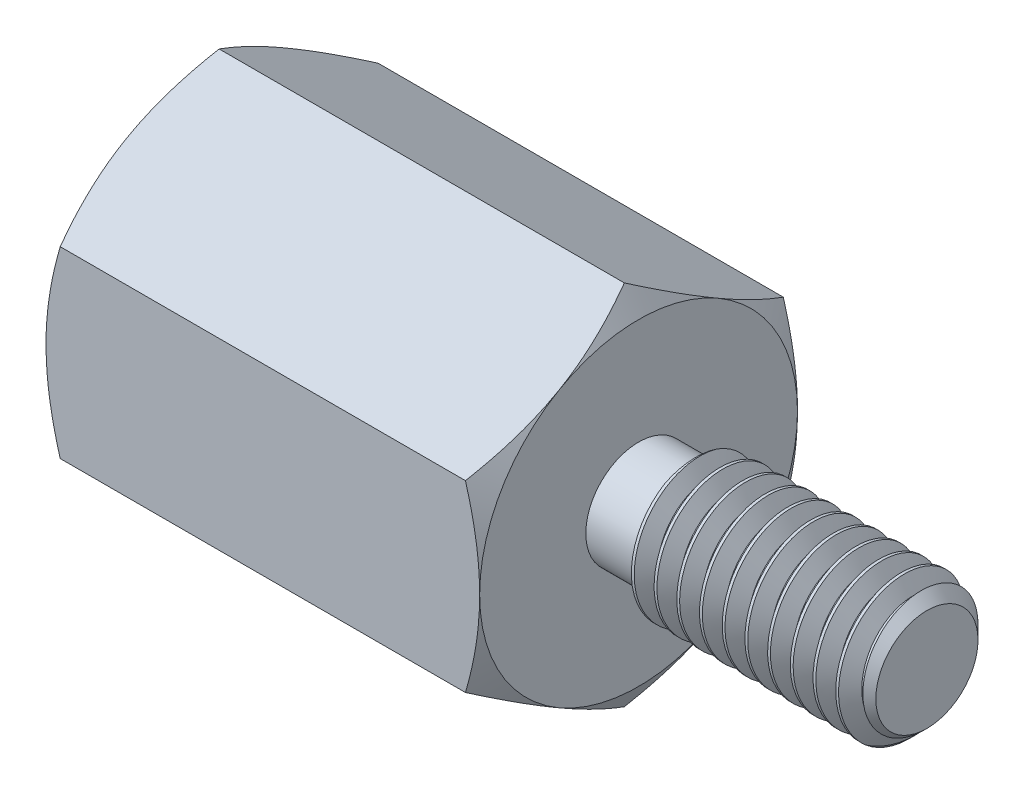
from build123d import *

# Parameters (mm, degrees)
EXTRUDE1_DEPTH    = 19.1
SKETCH3_R         = 4
EXTRUDE3_DEPTH    = 9.5
SWEEP1_PITCH      = 1.25
EXTRUDE7_DEPTH    = 22.889342986
SKETCH6_OUTSIDE_W = 101.026
SKETCH6_OUTSIDE_H = 103.192
SKETCH6_OUTSIDE_R = 7
EXTRUDE5_DEPTH    = 22.889343004
EXTRUDE5_DRAFT    = -60
SKETCH7_OUTSIDE_W = 101.026
SKETCH7_OUTSIDE_H = 103.192
SKETCH7_OUTSIDE_R = 7
EXTRUDE6_DEPTH    = 22.889342917
EXTRUDE6_DRAFT    = -60
SKETCH4_R         = 3
EXTRUDE4_DEPTH    = 12.7
CHAMFER1_SIZE     = 0.75
CUT_SWEEP1_PITCH  = 1
CUT_SWEEP1_FROM   = 0


with BuildPart() as part:
    # Sketch2 → Extrude1 (new body)
    with BuildSketch(Plane(origin=(19.1, 0, 0), x_dir=(0, 0, -1), z_dir=(1, 0, 0))):
        Polygon((0, 8.082903769), (-7, 4.041451884), (-7, -4.041451884), (0, -8.082903769), (7, -4.041451884), (7, 4.041451884), align=None)
    extrude(amount=-EXTRUDE1_DEPTH)

    # Sketch3 → Extrude3 (cut)
    with BuildSketch(Plane.ZY):
        Circle(SKETCH3_R)
    extrude(amount=-EXTRUDE3_DEPTH, mode=Mode.SUBTRACT)

    # Sweep1: arcs per turn and ends read off the stored shape
    # Sweep1: the profile of Sketch9 profile screwed along a right-hand helix through 9.6 turns, 8 arcs to a turn; built about Z, then put on its axis
    sweep1_z = Axis((0, 0, 0), (0, 0, 1))
    sweep1_corners = [(4.0003, 0, -0.547048205), (4.0003, 0, 0.547048205), (3.188101184, 0, 0.078125), (3.188101184, 0, -0.078125)]
    with BuildLine(mode=Mode.PRIVATE) as sweep1_profile:
        Line(sweep1_corners[0], sweep1_corners[1])
        Line(sweep1_corners[1], sweep1_corners[2])
        Line(sweep1_corners[2], sweep1_corners[3])
        Line(sweep1_corners[3], sweep1_corners[0])
    sweep1_cap = Face(sweep1_profile.wire())
    sweep1_turn_angles = [0, 22.5, 45, 67.5, 90, 112.5, 135, 157.5, 180, 202.5, 225, 247.5, 270, 292.5, 315, 337.5, 360]
    sweep1_turn_weights = [1, 0.9238795325112867, 1, 0.9238795325112867, 1, 0.9238795325112867, 1, 0.9238795325112867, 1, 0.9238795325112867, 1, 0.9238795325112867, 1, 0.9238795325112867, 1, 0.9238795325112867, 1]
    sweep1_turn_rails = [Edge.make_bspline([Vector(p[0], p[1], 0).rotate(sweep1_z, sweep1_turn_angles[k]) / sweep1_turn_weights[k] + Vector(0, 0, p[2] + SWEEP1_PITCH * sweep1_turn_angles[k] / 360) for k in range(17)], [0, 0, 0, 1, 1, 2, 2, 3, 3, 4, 4, 5, 5, 6, 6, 7, 7, 8, 8, 8], 2, sweep1_turn_weights) for p in sweep1_corners]
    sweep1_turn_sides = [Face.make_surface_from_curves(sweep1_turn_rails[p[0]], sweep1_turn_rails[p[1]]) for p in [(0, 1), (1, 2), (2, 3), (3, 0)]]
    sweep1_last_angles = [3240, 3262.5, 3285, 3307.5, 3330, 3352.5, 3375, 3397.5, 3420, 3438, 3456]
    sweep1_last_weights = [1, 0.9238795325112867, 1, 0.9238795325112867, 1, 0.9238795325112867, 1, 0.9238795325112867, 1, 0.9510565162951364, 1]
    sweep1_last_rails = [Edge.make_bspline([Vector(p[0], p[1], 0).rotate(sweep1_z, sweep1_last_angles[k]) / sweep1_last_weights[k] + Vector(0, 0, p[2] + SWEEP1_PITCH * sweep1_last_angles[k] / 360) for k in range(11)], [0, 0, 0, 1, 1, 2, 2, 3, 3, 4, 4, 5, 5, 5], 2, sweep1_last_weights) for p in sweep1_corners]
    sweep1_last_sides = [Face.make_surface_from_curves(sweep1_last_rails[p[0]], sweep1_last_rails[p[1]]) for p in [(0, 1), (1, 2), (2, 3), (3, 0)]]
    sweep1 = Plane(origin=(9.5, 0, 0), x_dir=(0, 1, 0), z_dir=(-1, 0, 0)) * Solid(Shell([*[p.moved(Location((0, 0, SWEEP1_PITCH * i))) for i in range(9) for p in sweep1_turn_sides], *sweep1_last_sides, sweep1_cap, sweep1_cap.rotate(sweep1_z, 3456).moved(Location((0, 0, SWEEP1_PITCH * 3456 / 360)))]))
    add(sweep1)

    # Sketch10 → Extrude7 (cut, through all)
    with BuildSketch(Plane.ZY):
        Polygon((0, 8.082903769), (-7, 4.041451884), (-7, -4.041451884), (0, -8.082903769), (7, -4.041451884), (7, 4.041451884), align=None)
    extrude(amount=EXTRUDE7_DEPTH, mode=Mode.SUBTRACT)

    # Extrude8 cone 1 section (through the dimple's axis) → Extrude8 (revolve, cut)
    with BuildSketch(Plane.ZX):
        Polygon((0, 0), (4.0762, 0), (0, 4.0762), align=None)
    revolve(axis=Axis((0, 0, 0), (1, 0, 0)), mode=Mode.SUBTRACT)


with BuildPart() as extrude5_tool:
    # Sketch6 outside → Extrude5 (with draft: the straight prism first)
    with BuildSketch(Plane(origin=(19.1, 0, 0), x_dir=(0, 0, -1), z_dir=(1, 0, 0))):
        Rectangle(SKETCH6_OUTSIDE_W, SKETCH6_OUTSIDE_H)
        Circle(SKETCH6_OUTSIDE_R, mode=Mode.SUBTRACT)
    extrude(amount=-EXTRUDE5_DEPTH)
    # Extrude5: the draft: its side faces are tilted about the plane it starts from
    extrude5_sides = [extrude5_tool.faces().sort_by_distance(p)[0] for p in [
        (7.655328498, -51.596, 0),
        (7.655328498, 0, -50.513),
        (7.655328498, 51.596, 0),
        (7.655328498, 0, 50.513),
        (7.655328498, 0, 7),
    ]]
    draft(extrude5_sides, Plane(origin=(19.1, 0, 0), x_dir=(0, 0, -1), z_dir=(1, 0, 0)), EXTRUDE5_DRAFT)


with BuildPart() as part_1:
    add(part.part)

    # Extrude5: cut by extrude5_tool
    add(extrude5_tool.part, mode=Mode.SUBTRACT)


with BuildPart() as extrude6_tool:
    # Sketch7 outside → Extrude6 (with draft: the straight prism first)
    with BuildSketch(Plane.ZY):
        Rectangle(SKETCH7_OUTSIDE_W, SKETCH7_OUTSIDE_H)
        Circle(SKETCH7_OUTSIDE_R, mode=Mode.SUBTRACT)
    extrude(amount=-EXTRUDE6_DEPTH)
    # Extrude6: the draft: its side faces are tilted about the plane it starts from
    extrude6_sides = [extrude6_tool.faces().sort_by_distance(p)[0] for p in [
        (11.444671458, -51.596, 0),
        (11.444671458, 0, 50.513),
        (11.444671458, 51.596, 0),
        (11.444671458, 0, -50.513),
        (11.444671458, 0, -7),
    ]]
    draft(extrude6_sides, Plane.ZY, EXTRUDE6_DRAFT)


with BuildPart() as part_2:
    add(part_1.part)

    # Extrude6: cut by extrude6_tool
    add(extrude6_tool.part, mode=Mode.SUBTRACT)


with BuildPart() as body_2:
    # Sketch4 → Extrude4 (new body)
    with BuildSketch(Plane(origin=(31.8, 0, 0), x_dir=(0, 0, -1), z_dir=(1, 0, 0))):
        Circle(SKETCH4_R)
    extrude(amount=-EXTRUDE4_DEPTH)

    # Chamfer1
    chamfer1_edges = [body_2.edges().sort_by_distance(p)[0] for p in [
        (31.8, 0, 3),
    ]]
    chamfer(chamfer1_edges, length=CHAMFER1_SIZE)

    # Cut-Sweep1: arcs per turn and ends read off the stored shape
    # Cut-Sweep1: the profile of Sketch13 profile screwed along a right-hand helix through 15.699997 turns, 8 arcs to a turn; built about Z, then put on its axis
    cut_sweep1_z = Axis((0, 0, 0), (0, 0, 1))
    cut_sweep1_corners = [(3.0003, 0, -1.437673205), (2.350480947, 0, -1.0625), (2.350480947, 0, -0.9375), (3.0003, 0, -0.562326795)]
    with BuildLine(mode=Mode.PRIVATE) as cut_sweep1_profile:
        Line(cut_sweep1_corners[0], cut_sweep1_corners[1])
        Line(cut_sweep1_corners[1], cut_sweep1_corners[2])
        Line(cut_sweep1_corners[2], cut_sweep1_corners[3])
        Line(cut_sweep1_corners[3], cut_sweep1_corners[0])
    cut_sweep1_cap = Face(cut_sweep1_profile.wire())
    cut_sweep1_turn_angles = [0, 22.5, 45, 67.5, 90, 112.5, 135, 157.5, 180, 202.5, 225, 247.5, 270, 292.5, 315, 337.5, 360]
    cut_sweep1_turn_weights = [1, 0.9238795325112867, 1, 0.9238795325112867, 1, 0.9238795325112867, 1, 0.9238795325112867, 1, 0.9238795325112867, 1, 0.9238795325112867, 1, 0.9238795325112867, 1, 0.9238795325112867, 1]
    cut_sweep1_turn_rails = [Edge.make_bspline([Vector(p[0], p[1], 0).rotate(cut_sweep1_z, cut_sweep1_turn_angles[k]) / cut_sweep1_turn_weights[k] + Vector(0, 0, p[2] + CUT_SWEEP1_PITCH * cut_sweep1_turn_angles[k] / 360) for k in range(17)], [0, 0, 0, 1, 1, 2, 2, 3, 3, 4, 4, 5, 5, 6, 6, 7, 7, 8, 8, 8], 2, cut_sweep1_turn_weights) for p in cut_sweep1_corners]
    cut_sweep1_turn_sides = [Face.make_surface_from_curves(cut_sweep1_turn_rails[p[0]], cut_sweep1_turn_rails[p[1]]) for p in [(0, 1), (1, 2), (2, 3), (3, 0)]]
    cut_sweep1_last_angles = [5400, 5422.5, 5445, 5467.5, 5490, 5512.5, 5535, 5557.5, 5580, 5602.5, 5625, 5638.4995, 5651.999]
    cut_sweep1_last_weights = [1, 0.9238795325112867, 1, 0.9238795325112867, 1, 0.9238795325112867, 1, 0.9238795325112867, 1, 0.9238795325112867, 1, 0.9723719575557633, 1]
    cut_sweep1_last_rails = [Edge.make_bspline([Vector(p[0], p[1], 0).rotate(cut_sweep1_z, cut_sweep1_last_angles[k]) / cut_sweep1_last_weights[k] + Vector(0, 0, p[2] + CUT_SWEEP1_PITCH * cut_sweep1_last_angles[k] / 360) for k in range(13)], [0, 0, 0, 1, 1, 2, 2, 3, 3, 4, 4, 5, 5, 6, 6, 6], 2, cut_sweep1_last_weights) for p in cut_sweep1_corners]
    cut_sweep1_last_sides = [Face.make_surface_from_curves(cut_sweep1_last_rails[p[0]], cut_sweep1_last_rails[p[1]]) for p in [(0, 1), (1, 2), (2, 3), (3, 0)]]
    cut_sweep1 = Plane(origin=(19.1, 0, 0), x_dir=(0, 1, 0), z_dir=(1, 0, 0)) * split(Solid(Shell([*[p.moved(Location((0, 0, CUT_SWEEP1_PITCH * i))) for i in range(15) for p in cut_sweep1_turn_sides], *cut_sweep1_last_sides, cut_sweep1_cap, cut_sweep1_cap.rotate(cut_sweep1_z, 5651.999).moved(Location((0, 0, CUT_SWEEP1_PITCH * 5651.999 / 360)))])), bisect_by=Plane.XY.offset(CUT_SWEEP1_FROM), keep=Keep.TOP, mode=Mode.PRIVATE)
    add(cut_sweep1, mode=Mode.SUBTRACT)

    # Sketch14 → Cut-Revolve1 (revolve, cut)
    with BuildSketch(Plane.XY, mode=Mode.PRIVATE) as cut_revolve1_sk:
        Polygon((19.1, 3), (19.1, 2.325080947), (21.222680903, 2.325080947), (21.6123456, 3), align=None)
    revolve(cut_revolve1_sk.sketch.rotate(Axis((0, 0, 0), (1, 0, 0)), 90), axis=Axis((0, 0, 0), (1, 0, 0)), mode=Mode.SUBTRACT)

    # Combine1: union part
    add(part_2.part)


solid = body_2.part
